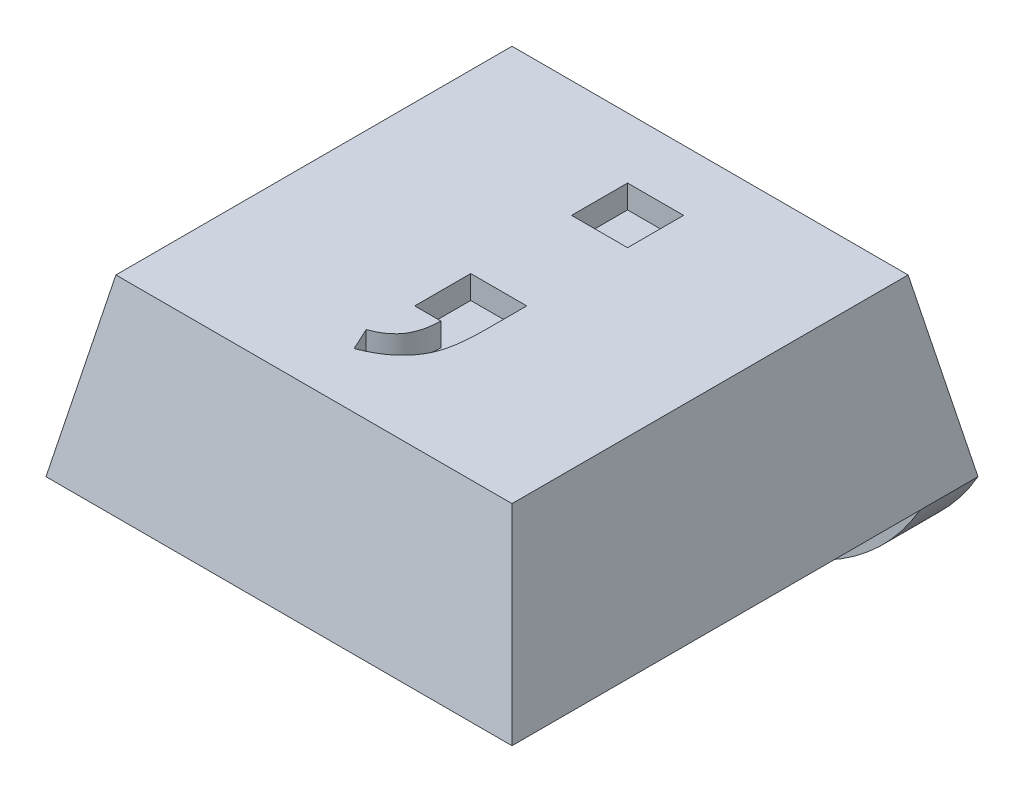
from build123d import *

# Parameters (mm, degrees)
SKETCH1_W               = 8
SKETCH1_H               = 8
BOSS_EXTRUDE1_DEPTH     = 3
CUT_EXTRUDE1_DEPTH      = 12.704699911
CUT_EXTRUDE1_DEPTH_BACK = 12.704699911
CUT_EXTRUDE2_DEPTH      = 11
SKETCH4_R               = 1.75
CUT_EXTRUDE3_DEPTH      = 0.4
SKETCH5_W               = 8
SKETCH5_H               = 1
BOSS_EXTRUDE2_DEPTH     = 2
FILLET1_R               = 4
SKETCH6_W               = 0.961538461
SKETCH6_H               = 0.961538462
CUT_EXTRUDE4_DEPTH      = 0.4


with BuildPart() as part:
    # Sketch1 → Boss-Extrude1 (new body)
    with BuildSketch(Plane(origin=(0, 0, 0), x_dir=(1, 0, 0), z_dir=(0, 1, 0))):
        with Locations((4, 4)):
            Rectangle(SKETCH1_W, SKETCH1_H)
    extrude(amount=BOSS_EXTRUDE1_DEPTH)

    # Sketch2 → Cut-Extrude1 (cut, two sides: drawn at the far end of the back side and taken through both)
    with BuildSketch(Plane.XY.offset(-CUT_EXTRUDE1_DEPTH_BACK)):
        Polygon((0, 0), (0.6, 3), (0, 3), align=None)
        Polygon((8, 0), (7.4, 3), (8, 3), align=None)
    extrude(amount=CUT_EXTRUDE1_DEPTH + CUT_EXTRUDE1_DEPTH_BACK, mode=Mode.SUBTRACT)

    # Sketch3 → Cut-Extrude2 (cut)
    with BuildSketch(Plane(origin=(0, 0, 0), x_dir=(0, 0, -1), z_dir=(1, 0, 0))):
        Polygon((0, 0), (0.6, 3), (0, 3), align=None)
        Polygon((8, 3), (7.4, 3), (8, 0), align=None)
    extrude(amount=CUT_EXTRUDE2_DEPTH, mode=Mode.SUBTRACT)

    # Sketch4 → Cut-Extrude3 (cut)
    with BuildSketch(Plane.XZ):
        with Locations(Location((4, -3.75, 0), (0, 0, 270))):
            Circle(SKETCH4_R)
    extrude(amount=-CUT_EXTRUDE3_DEPTH, mode=Mode.SUBTRACT)

    # Sketch5 → Boss-Extrude2 (add)
    with BuildSketch(Plane.XZ):
        with Locations((4, -7.5)):
            Rectangle(SKETCH5_W, SKETCH5_H)
    extrude(amount=BOSS_EXTRUDE2_DEPTH)

    # Fillet1
    # the kernel refuses this fillet: 4 mm, written as the material it takes off along each edge
    with BuildSketch(Plane(origin=(8, -2, -16.660254038), x_dir=(0, 1, 0), z_dir=(0, 0, 1)), Plane(origin=(0, -2, 1.660254038), x_dir=(0, 1, 0), z_dir=(0, 0, -1))) as fillet1_piece_1:
        with BuildLine():
            CenterArc((4, 3.464101615), FILLET1_R, 180, 60)
            Line((0, 3.464101615), (-0.08, 3.464101615))
            Line((-0.08, 3.464101615), (-0.08, 0))
            Line((-0.08, 0), (0, -0.08))
            ThreePointArc((0, -0.08), (1, -0.08), (1.96, -0.069282032))
            Line((1.96, -0.069282032), (2, 0))
        make_face()
    extrude(amount=18.320508076, mode=Mode.SUBTRACT)

    # Sketch6 → Cut-Extrude4 (cut)
    with BuildSketch(Plane(origin=(0, 3, 0), x_dir=(1, 0, 0), z_dir=(0, 1, 0))):
        with Locations((4.106375193, 5.877622732)):
            Rectangle(SKETCH6_W, SKETCH6_H)
        with BuildLine():
            Line((3.625605963, 3.666084271), (4.587144424, 3.666084271))
            Line((4.587144424, 3.666084271), (4.587144424, 2.966965681))
            add(Edge.make_bspline(
                [(4.587144424, 2.966965681), (4.586700802, 2.899821455), (4.585863185, 2.773044347), (4.571180714, 2.594207821), (4.550779556, 2.437158718), (4.518324342, 2.299878361), (4.47486997, 2.175902827), (4.413432502, 2.062461013), (4.337876173, 1.953901165), (4.245458326, 1.85350819), (4.139144335, 1.760654771), (4.017702284, 1.679908688), (3.88401418, 1.607967915), (3.787969656, 1.570094118), (3.738787052, 1.550699655)],
                knots=[0, 0, 0, 0, 1.347156832, 2.543608823, 3.599300285, 4.522475688, 5.370350604, 6.227678973, 7.103274953, 8.018757603, 8.959280198, 9.929437417, 10.939703653, 12, 12, 12, 12], degree=3))
            Line((3.738787052, 1.550699655), (3.561503399, 1.93531504))
            add(Edge.make_bspline(
                [(3.561503399, 1.93531504), (3.604439047, 1.952873279), (3.686527672, 1.986442858), (3.795938691, 2.052543314), (3.885105421, 2.129792439), (3.955780801, 2.218165676), (4.006656804, 2.32038588), (4.045456087, 2.435104657), (4.0674697, 2.56519407), (4.07197182, 2.656725854), (4.074323911, 2.704545809)],
                knots=[0, 0, 0, 0, 1.115416734, 2.132564161, 3.06091458, 3.941973359, 4.836922823, 5.794989041, 6.848011894, 8, 8, 8, 8], degree=3))
            Line((4.074323911, 2.704545809), (3.625605963, 2.704545809))
            Line((3.625605963, 2.704545809), (3.625605963, 3.666084271))
        make_face()
    extrude(amount=-CUT_EXTRUDE4_DEPTH, mode=Mode.SUBTRACT)


solid = part.part
